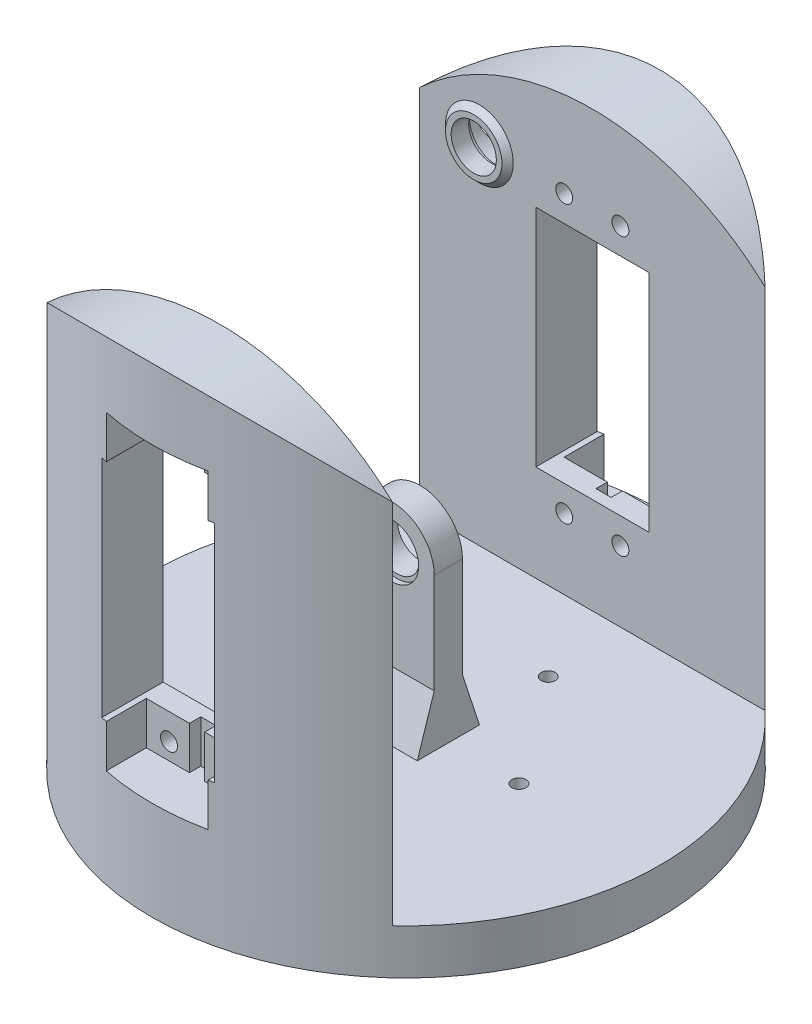
from build123d import *

# Parameters (mm, degrees)
SKETCH_1_R                     = 45
EXTRUDE_1_DEPTH                = 40
REVOLVE_1_ANGLE                = 180
CUT_EXTRUDE_2_DEPTH            = 107.183802908
CUT_EXTRUDE_2_DEPTH_BACK       = 107.183802908
SKETCH_8_R                     = 29.5
EXTRUDE_2_DEPTH                = 6
CUT_EXTRUDE_5_DEPTH            = 124.830529354
CUT_EXTRUDE_5_DEPTH_BACK       = 124.830529354
SKETCH_9_W                     = 18
SKETCH_9_H                     = 55
SKETCH_9_W_2                   = 20
SKETCH_9_H_2                   = 39.84
SKETCH_9_4_W                   = 7.65
SKETCH_9_4_H                   = 7.58
SKETCH_9_4_R                   = 1.5
EXTRUDE_3_DEPTH                = 4
SKETCH_9_5_W                   = 2.7
SKETCH_9_5_H                   = 7.58
EXTRUDE_4_DEPTH                = 2
HOLE_WIZARD_M3_1_D             = 2.5
CUT_EXTRUDE_6_DEPTH            = 107.183802908
CUT_EXTRUDE_6_DEPTH_BACK       = 107.183802908
SKETCH_10_OUTSIDE_W            = 123.292
SKETCH_10_OUTSIDE_H            = 123.292
SKETCH_10_OUTSIDE_R            = 45
SKETCH_14_R                    = 2.5
EXTRUDE_5_DEPTH                = 2.5
EXTRUDE_6_DEPTH                = 15
HOLE_WIZARD_M3_1_2_D           = 8
HOLE_WIZARD_M3_1_2_CBORE_D     = 9.5
HOLE_WIZARD_M3_1_2_CBORE_DEPTH = 0.9
SKETCH_23_R                    = 5
CUT_EXTRUDE_8_DEPTH            = 124.830529354
EXTRUDE_START                  = -36
EXTRUDE_7_OUTLINE_R            = 5
EXTRUDE_7_DEPTH                = 4
HOLE_WIZARD_M5_1_D             = 8
HOLE_WIZARD_M5_1_DEPTH         = 10
HOLE_WIZARD_M5_1_CBORE_D       = 9.5
HOLE_WIZARD_M5_1_CBORE_DEPTH   = 0.9
HOLE_WIZARD_M5_1_TIP           = 2.403442476
CHAMFER_1_SIZE                 = 1


# Read off the part's stored shape, not the designer's step: 凸台-拉伸7
with BuildPart() as part:
    # 草图1 → 凸台-拉伸1 (new body)
    with BuildSketch(Plane(origin=(0, 0, 0), x_dir=(1, 0, 0), z_dir=(0, 1, 0))):
        with Locations(Location((0, 0, 0), (0, 0, 270))):
            Circle(SKETCH_1_R)
    extrude(amount=EXTRUDE_1_DEPTH)

    # 草图3 → 旋转1 (revolve)
    with BuildSketch(Plane(origin=(0, 40, 0), x_dir=(1, 0, 0), z_dir=(0, 1, 0))):
        with BuildLine():
            ThreePointArc((45, 0), (31.819805153, 31.819805153), (0, 45))
            Line((0, 45), (0, 0))
            Line((0, 0), (45, 0))
        make_face()
        with BuildLine():
            Line((45, 0), (0, 0))
            Line((0, 0), (0, -45))
            ThreePointArc((0, -45), (31.819805153, -31.819805153), (45, 0))
        make_face()
        with BuildLine():
            Line((45, 45), (0, 45))
            ThreePointArc((0, 45), (31.819805153, 31.819805153), (45, 0))
            Line((45, 0), (45, 45))
        make_face()
        with BuildLine():
            Line((45, -45), (45, 0))
            ThreePointArc((45, 0), (31.819805153, -31.819805153), (0, -45))
            Line((0, -45), (45, -45))
        make_face()
    revolve(axis=Axis((0, 40, -45), (0, 0, 1)), revolution_arc=REVOLVE_1_ANGLE)

    # 草图4 → 切除-拉伸2 (cut, two sides: drawn at the far end of the back side and taken through both)
    with BuildSketch(Plane(origin=(0, 0, 0), x_dir=(0, 0, -1), z_dir=(1, 0, 0)).offset(-CUT_EXTRUDE_2_DEPTH_BACK)):
        Polygon((33, 162), (-33, 162), (-33, 14.4), (-33, 8), (-26.603931708, 8), (26.603931708, 8), (33, 8), (33, 14.4), align=None)
    extrude(amount=CUT_EXTRUDE_2_DEPTH + CUT_EXTRUDE_2_DEPTH_BACK, mode=Mode.SUBTRACT)

    # 草图8 → 凸台-拉伸2 (add)
    with BuildSketch(Plane.XZ):
        with Locations(Location((0, 0, 0), (0, 0, 270))):
            Circle(SKETCH_8_R)
    extrude(amount=EXTRUDE_2_DEPTH)

    # 草图9 → 切除-拉伸5 (cut, two sides: drawn at the far end of the back side and taken through both)
    with BuildSketch(Plane.XY.offset(-33).offset(-CUT_EXTRUDE_5_DEPTH_BACK)):
        with Locations((0, 45)):
            Rectangle(SKETCH_9_W, SKETCH_9_H)
        with Locations((0, 45)):
            Rectangle(SKETCH_9_W_2, SKETCH_9_H_2)
    extrude(amount=CUT_EXTRUDE_5_DEPTH + CUT_EXTRUDE_5_DEPTH_BACK, mode=Mode.SUBTRACT)

    # 草图9<4> → 凸台-拉伸3 (add)
    # profile 1 of 4: a face of its own
    with BuildSketch(Plane.XY.offset(-33)):
        with Locations((5.175, 21.29)):
            Rectangle(SKETCH_9_4_W, SKETCH_9_4_H)
        with Locations((4.975, 20.47)):
            Circle(SKETCH_9_4_R, mode=Mode.SUBTRACT)
    # profile 2 of 4: a face of its own
    with BuildSketch(Plane.XY.offset(-33)):
        with Locations((-5.175, 21.29)):
            Rectangle(SKETCH_9_4_W, SKETCH_9_4_H)
        with Locations((-4.975, 20.47)):
            Circle(SKETCH_9_4_R, mode=Mode.SUBTRACT)
    # profile 3 of 4: a face of its own
    with BuildSketch(Plane.XY.offset(-33)):
        with Locations((5.175, 68.71)):
            Rectangle(SKETCH_9_4_W, SKETCH_9_4_H)
        with Locations((4.975, 69.53)):
            Circle(SKETCH_9_4_R, mode=Mode.SUBTRACT)
    # profile 4 of 4: a face of its own
    with BuildSketch(Plane.XY.offset(-33)):
        with Locations((-5.175, 68.71)):
            Rectangle(SKETCH_9_4_W, SKETCH_9_4_H)
        with Locations((-4.975, 69.53)):
            Circle(SKETCH_9_4_R, mode=Mode.SUBTRACT)
    extrude_3 = extrude(amount=-EXTRUDE_3_DEPTH)

    # 草图9<5> → 凸台-拉伸4 (add)
    with BuildSketch(Plane.XY.offset(-33)):
        with Locations((0, 21.29)):
            Rectangle(SKETCH_9_5_W, SKETCH_9_5_H)
        with Locations((0, 68.71)):
            Rectangle(SKETCH_9_5_W, SKETCH_9_5_H)
    extrude_4 = extrude(amount=-EXTRUDE_4_DEPTH)

    # 镜向1: 凸台-拉伸3, 凸台-拉伸4 across plane
    add(extrude_3.mirror(Plane.XY))
    add(extrude_4.mirror(Plane.XY))

    # Hole Wizard M3 _1 (through all)
    with Locations(Plane.XZ.offset(6)):
        with Locations((6.180339887, 19.021130326), (20, 0), (6.180339887, -19.021130326), (-16.180339887, -11.755705046), (-16.180339887, 11.755705046)):
            Hole(HOLE_WIZARD_M3_1_D / 2)

    # 草图10 outside → 切除-拉伸6 (cut, two sides: drawn at the far end of the back side and taken through both)
    with BuildSketch(Plane(origin=(0, 0, 0), x_dir=(1, 0, 0), z_dir=(0, 1, 0)).offset(-CUT_EXTRUDE_6_DEPTH_BACK)):
        Rectangle(SKETCH_10_OUTSIDE_W, SKETCH_10_OUTSIDE_H)
        with Locations(Location((0, 0, 0), (0, 0, 132.833428066))):
            Circle(SKETCH_10_OUTSIDE_R, mode=Mode.SUBTRACT)
    extrude(amount=CUT_EXTRUDE_6_DEPTH + CUT_EXTRUDE_6_DEPTH_BACK, mode=Mode.SUBTRACT)

    # 草图14 → 凸台-拉伸5 (add, symmetric)
    # profile 1 of 2: a face of its own
    with BuildSketch(Plane.XY):
        with BuildLine():
            Line((7.5, 35), (7.5, 8))
            Line((7.5, 8), (-7.5, 8))
            Line((-7.5, 8), (-7.5, 35))
            ThreePointArc((-7.5, 35), (0, 42.5), (7.5, 35))
        make_face()
        with Locations((0, 35)):
            Circle(SKETCH_14_R, mode=Mode.SUBTRACT)
    # profile 2 of 2: a face of its own
    with BuildSketch(Plane.XY):
        with Locations((0, 35)):
            Circle(SKETCH_14_R)
    extrude(amount=EXTRUDE_5_DEPTH, both=True)

    # 草图16 → 凸台-拉伸6 (add)
    with BuildSketch(Plane(origin=(7.5, 0, 0), x_dir=(0, 0, -1), z_dir=(1, 0, 0))):
        Polygon((2.5, 17.233050612), (5.5, 8), (2.5, 8), align=None)
    extrude_6 = extrude(amount=-EXTRUDE_6_DEPTH)

    # 镜向2: 凸台-拉伸6 across plane
    add(extrude_6.mirror(Plane.XY))

    # Hole Wizard M3 _1 2 (through all)
    with Locations(Plane.XY.offset(2.5)):
        with Locations((0, 35)):
            CounterBoreHole(HOLE_WIZARD_M3_1_2_D / 2, HOLE_WIZARD_M3_1_2_CBORE_D / 2, HOLE_WIZARD_M3_1_2_CBORE_DEPTH)

    # 草图23 → 切除-拉伸8 (cut, through all)
    with BuildSketch(Plane.XY.offset(-33)):
        with Locations((-20, 69.641016151)):
            Circle(SKETCH_23_R)
    extrude(amount=-CUT_EXTRUDE_8_DEPTH, mode=Mode.SUBTRACT)

    # 凸台-拉伸7 outline → 凸台-拉伸7 (add)
    with BuildSketch(Plane.XY.offset(EXTRUDE_START)):
        with Locations((-20, 69.641016151)):
            Circle(EXTRUDE_7_OUTLINE_R)
    extrude(amount=EXTRUDE_7_DEPTH)

    # M5 六角头螺栓的柱形沉头孔1
    with Locations(Plane(origin=(0, 0, -36), x_dir=(1, 0, 0), z_dir=(0, 0, -1))):
        with Locations((-20, -69.641016151)):
            CounterBoreHole(HOLE_WIZARD_M5_1_D / 2, HOLE_WIZARD_M5_1_CBORE_D / 2, HOLE_WIZARD_M5_1_CBORE_DEPTH, depth=HOLE_WIZARD_M5_1_DEPTH)
            with Locations((0, 0, -(HOLE_WIZARD_M5_1_DEPTH + HOLE_WIZARD_M5_1_TIP / 2))):  # 118° drill point
                Cone(0, HOLE_WIZARD_M5_1_D / 2, HOLE_WIZARD_M5_1_TIP, mode=Mode.SUBTRACT)

    # 倒角1
    chamfer_1_edges = [part.edges().sort_by_distance(p)[0] for p in [
        (-25, 69.641016151, -33),
    ]]
    chamfer(chamfer_1_edges, length=CHAMFER_1_SIZE - 0.0001)  # a hair under: the kernel refuses the full size


solid = part.part
